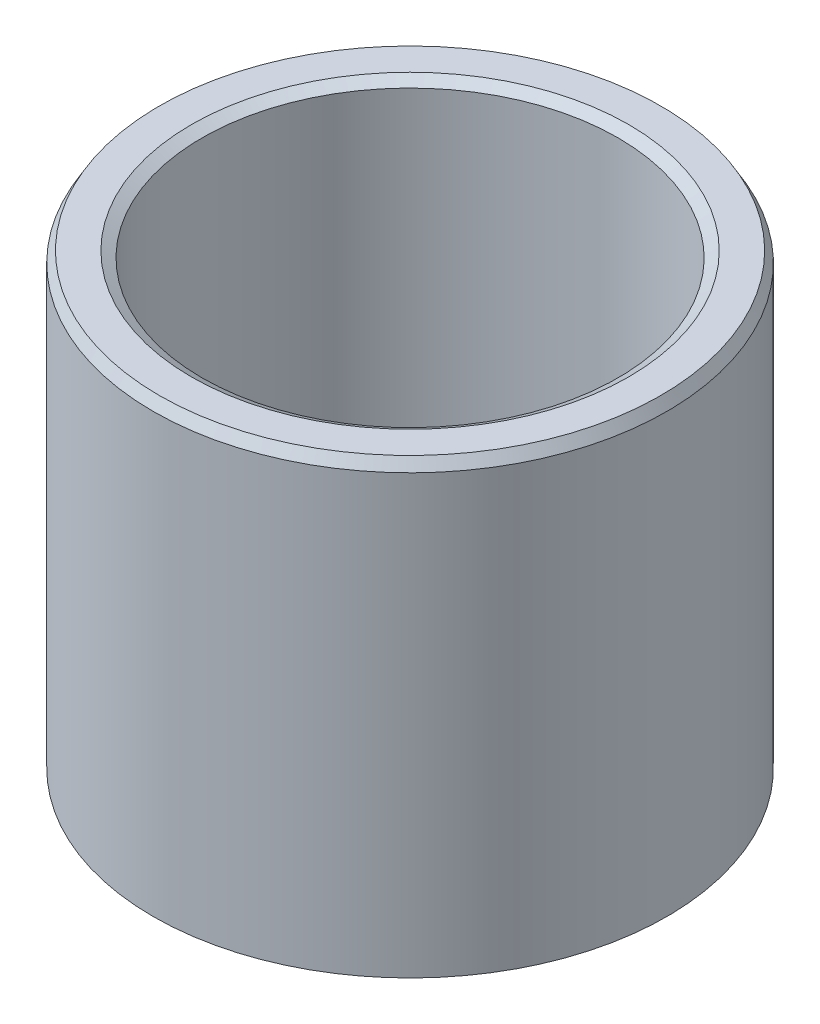
from build123d import *
from OCP.BRepFilletAPI import BRepFilletAPI_MakeChamfer

# Parameters (mm, degrees)
SKETCH1_R           = 42.5
BOSS_EXTRUDE1_DEPTH = 75.154286851
SKETCH2_R           = 34.400132179
CUT_EXTRUDE1_DEPTH  = 97.23235855
CHAMFER1_SIZE       = 1.764874187
CHAMFER1_SIZE2      = 1.018950587


with BuildPart() as part:
    # Sketch1 → Boss-Extrude1 (new body)
    with BuildSketch(Plane(origin=(0, 0, 0), x_dir=(1, 0, 0), z_dir=(0, 1, 0))):
        Circle(SKETCH1_R)
    extrude(amount=BOSS_EXTRUDE1_DEPTH)

    # Sketch2 → Cut-Extrude1 (cut, through all)
    with BuildSketch(Plane(origin=(0, 0, 0), x_dir=(1, 0, 0), z_dir=(0, 1, 0))):
        Circle(SKETCH2_R)
    extrude(amount=CUT_EXTRUDE1_DEPTH, mode=Mode.SUBTRACT)

    # Chamfer1: one chamfer whose edges measure the first distance from different faces: ONE call of the kernel's chamfer builder (chamfer() names one face for all edges)
    chamfer1_edges_1 = [part.edges().sort_by_distance(p)[0] for p in [
        (-34.400132179, 75.154286851, 0),
    ]]
    chamfer1_side_1 = [part.faces().sort_by_distance(p)[0] for p in [
        (-41.297918472, 75.154286851, 0),
    ]]
    chamfer1_edges_2 = [part.edges().sort_by_distance(p)[0] for p in [
        (-34.400132179, 0, 0),
    ]]
    chamfer1_side_2 = [part.faces().sort_by_distance(p)[0] for p in [
        (-34.400132179, 37.577143426, 0),
    ]]
    chamfer1_edges_3 = [part.edges().sort_by_distance(p)[0] for p in [
        (-42.5, 0, 0),
    ]]
    chamfer1_side_3 = [part.faces().sort_by_distance(p)[0] for p in [
        (-41.297918472, 0, 0),
    ]]
    chamfer1_edges_4 = [part.edges().sort_by_distance(p)[0] for p in [
        (-42.5, 75.154286851, 0),
    ]]
    chamfer1_side_4 = [part.faces().sort_by_distance(p)[0] for p in [
        (-42.5, 37.577143426, 0),
    ]]
    chamfer1 = BRepFilletAPI_MakeChamfer(part.part.solid().wrapped)
    for e in chamfer1_edges_1:
        chamfer1.Add(CHAMFER1_SIZE, CHAMFER1_SIZE2, e.wrapped, chamfer1_side_1[0].wrapped)  # the first distance lies on this face
    for e in chamfer1_edges_2:
        chamfer1.Add(CHAMFER1_SIZE, CHAMFER1_SIZE2, e.wrapped, chamfer1_side_2[0].wrapped)  # the first distance lies on this face
    for e in chamfer1_edges_3:
        chamfer1.Add(CHAMFER1_SIZE, CHAMFER1_SIZE2, e.wrapped, chamfer1_side_3[0].wrapped)  # the first distance lies on this face
    for e in chamfer1_edges_4:
        chamfer1.Add(CHAMFER1_SIZE, CHAMFER1_SIZE2, e.wrapped, chamfer1_side_4[0].wrapped)  # the first distance lies on this face
    add(Compound.cast(chamfer1.Shape()), mode=Mode.REPLACE)


solid = part.part
